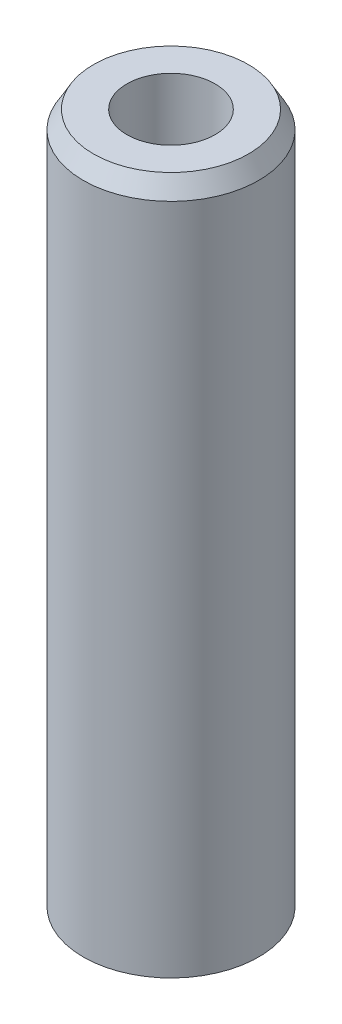
from build123d import *
from OCP.BRepFilletAPI import BRepFilletAPI_MakeChamfer

# Parameters (mm, degrees)
SKETCH1_R           = 7.5
BOSS_EXTRUDE1_DEPTH = 59.880968919
SKETCH2_R           = 3.76996331
CUT_EXTRUDE1_DEPTH  = 61.813077859
CHAMFER1_SIZE       = 1.517456427
CHAMFER1_SIZE2      = 0.876103876


with BuildPart() as part:
    # Sketch1 → Boss-Extrude1 (new body)
    with BuildSketch(Plane(origin=(0, 0, 0), x_dir=(1, 0, 0), z_dir=(0, 1, 0))):
        Circle(SKETCH1_R)
    extrude(amount=BOSS_EXTRUDE1_DEPTH)

    # Sketch2 → Cut-Extrude1 (cut, through all)
    with BuildSketch(Plane(origin=(0, 0, 0), x_dir=(1, 0, 0), z_dir=(0, 1, 0))):
        Circle(SKETCH2_R)
    extrude(amount=CUT_EXTRUDE1_DEPTH, mode=Mode.SUBTRACT)

    # Chamfer1: one chamfer whose edges measure the first distance from different faces: ONE call of the kernel's chamfer builder (chamfer() names one face for all edges)
    chamfer1_edges_1 = [part.edges().sort_by_distance(p)[0] for p in [
        (-7.5, 59.880968919, 0),
    ]]
    chamfer1_side_1 = [part.faces().sort_by_distance(p)[0] for p in [
        (-7.5, 29.940484459, 0),
    ]]
    chamfer1_edges_2 = [part.edges().sort_by_distance(p)[0] for p in [
        (-7.5, 0, 0),
    ]]
    chamfer1_side_2 = [part.faces().sort_by_distance(p)[0] for p in [
        (-7.287867966, 0, 0),
    ]]
    chamfer1 = BRepFilletAPI_MakeChamfer(part.part.solid().wrapped)
    for e in chamfer1_edges_1:
        chamfer1.Add(CHAMFER1_SIZE, CHAMFER1_SIZE2, e.wrapped, chamfer1_side_1[0].wrapped)  # the first distance lies on this face
    for e in chamfer1_edges_2:
        chamfer1.Add(CHAMFER1_SIZE, CHAMFER1_SIZE2, e.wrapped, chamfer1_side_2[0].wrapped)  # the first distance lies on this face
    add(Compound.cast(chamfer1.Shape()), mode=Mode.REPLACE)


solid = part.part
